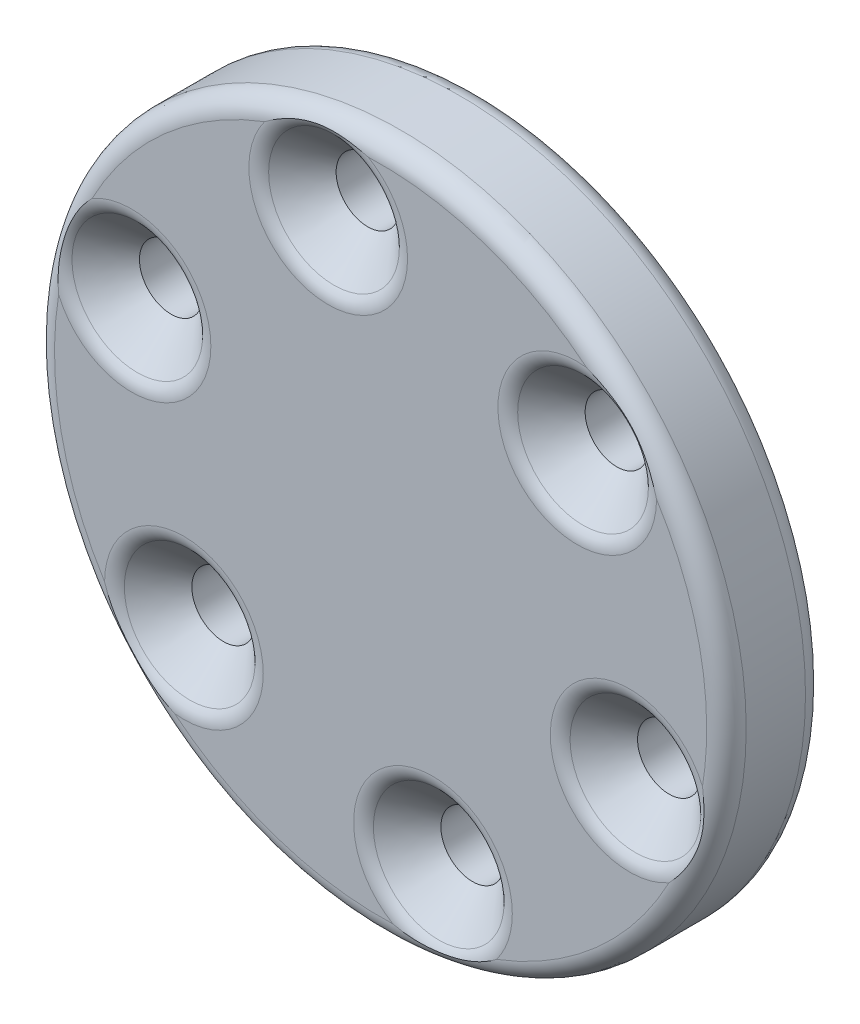
from build123d import *

# Parameters (mm, degrees)
ESQUISSE1_R        = 17.5
ESQUISSE1_R_2      = 1.6
BOSS_EXTRU_1_DEPTH = 5
CHANFREIN1_SIZE    = 2
CONG_2_R           = 1


with BuildPart() as part:
    # Esquisse1 → Boss.-Extru.1 (new body)
    with BuildSketch(Plane.XY):
        Circle(ESQUISSE1_R)
        with Locations((-2.65015328, 13.020556544)):
            Circle(ESQUISSE1_R_2, mode=Mode.SUBTRACT)
        with Locations((9.951056099, 8.805378336)):
            Circle(ESQUISSE1_R_2, mode=Mode.SUBTRACT)
        with Locations((12.601209379, -4.215178208)):
            Circle(ESQUISSE1_R_2, mode=Mode.SUBTRACT)
        with Locations((2.65015328, -13.020556544)):
            Circle(ESQUISSE1_R_2, mode=Mode.SUBTRACT)
        with Locations((-9.951056099, -8.805378336)):
            Circle(ESQUISSE1_R_2, mode=Mode.SUBTRACT)
        with Locations((-12.601209379, 4.215178208)):
            Circle(ESQUISSE1_R_2, mode=Mode.SUBTRACT)
    extrude(amount=BOSS_EXTRU_1_DEPTH)

    # Chanfrein1
    chanfrein1_edges = [part.edges().sort_by_distance(p)[0] for p in [
        (-14.201209379, 4.215178208, 5),
        (-11.551056099, -8.805378336, 5),
        (1.05015328, -13.020556544, 5),
        (11.001209379, -4.215178208, 5),
        (8.351056099, 8.805378336, 5),
        (-4.25015328, 13.020556544, 5),
    ]]
    chamfer(chanfrein1_edges, length=CHANFREIN1_SIZE)

    # Congé2
    # the kernel refuses this fillet: 1 mm, written as the material it takes off along each edge
    with BuildSketch(Plane(origin=(12.601209379, -4.215178208, 0), x_dir=(1, 0, 0), z_dir=(0, -1, 0))) as cong_2_piece_1:
        with BuildLine():
            CenterArc((1.6 + CONG_2_R, CONG_2_R), CONG_2_R, 180, 90)
            Line((1.6, CONG_2_R), (1.6, 0))
            Line((1.6, 0), (1.6 + CONG_2_R, 0))
        make_face()
    revolve(axis=Axis((12.601209379, -4.215178208, 0), (0, 0, 1)), mode=Mode.SUBTRACT)
    with BuildSketch(Plane(origin=(2.65015328, -13.020556544, 0), x_dir=(1, 0, 0), z_dir=(0, -1, 0))) as cong_2_piece_2:
        with BuildLine():
            CenterArc((1.6 + CONG_2_R, CONG_2_R), CONG_2_R, 180, 90)
            Line((1.6, CONG_2_R), (1.6, 0))
            Line((1.6, 0), (1.6 + CONG_2_R, 0))
        make_face()
    revolve(axis=Axis((2.65015328, -13.020556544, 0), (0, 0, 1)), mode=Mode.SUBTRACT)
    with BuildSketch(Plane(origin=(-9.951056099, -8.805378336, 0), x_dir=(1, 0, 0), z_dir=(0, -1, 0))) as cong_2_piece_3:
        with BuildLine():
            CenterArc((1.6 + CONG_2_R, CONG_2_R), CONG_2_R, 180, 90)
            Line((1.6, CONG_2_R), (1.6, 0))
            Line((1.6, 0), (1.6 + CONG_2_R, 0))
        make_face()
    revolve(axis=Axis((-9.951056099, -8.805378336, 0), (0, 0, 1)), mode=Mode.SUBTRACT)
    with BuildSketch(Plane(origin=(-12.601209379, 4.215178208, 0), x_dir=(1, 0, 0), z_dir=(0, -1, 0))) as cong_2_piece_4:
        with BuildLine():
            CenterArc((1.6 + CONG_2_R, CONG_2_R), CONG_2_R, 180, 90)
            Line((1.6, CONG_2_R), (1.6, 0))
            Line((1.6, 0), (1.6 + CONG_2_R, 0))
        make_face()
    revolve(axis=Axis((-12.601209379, 4.215178208, 0), (0, 0, 1)), mode=Mode.SUBTRACT)
    with BuildSketch(Plane(origin=(-12.601209379, 4.215178208, 5), x_dir=(1, 0, 0), z_dir=(0, -1, 0))) as cong_2_piece_5:
        with BuildLine():
            CenterArc((3.6 + CONG_2_R * 0.414213562373, -CONG_2_R), CONG_2_R, 90, 45)
            Line((3.6 - CONG_2_R * 0.292893218813, -CONG_2_R * 0.292893218813), (3.6, 0))
            Line((3.6, 0), (3.6 + CONG_2_R * 0.414213562373, 0))
        make_face()
    revolve(axis=Axis((-12.601209379, 4.215178208, 5), (0, 0, 1)), mode=Mode.SUBTRACT)
    with BuildSketch(Plane(origin=(-9.951056099, -8.805378336, 5), x_dir=(1, 0, 0), z_dir=(0, -1, 0))) as cong_2_piece_6:
        with BuildLine():
            CenterArc((3.6 + CONG_2_R * 0.414213562373, -CONG_2_R), CONG_2_R, 90, 45)
            Line((3.6 - CONG_2_R * 0.292893218813, -CONG_2_R * 0.292893218813), (3.6, 0))
            Line((3.6, 0), (3.6 + CONG_2_R * 0.414213562373, 0))
        make_face()
    revolve(axis=Axis((-9.951056099, -8.805378336, 5), (0, 0, 1)), mode=Mode.SUBTRACT)
    with BuildSketch(Plane(origin=(2.65015328, -13.020556544, 5), x_dir=(1, 0, 0), z_dir=(0, -1, 0))) as cong_2_piece_7:
        with BuildLine():
            CenterArc((3.6 + CONG_2_R * 0.414213562373, -CONG_2_R), CONG_2_R, 90, 45)
            Line((3.6 - CONG_2_R * 0.292893218813, -CONG_2_R * 0.292893218813), (3.6, 0))
            Line((3.6, 0), (3.6 + CONG_2_R * 0.414213562373, 0))
        make_face()
    revolve(axis=Axis((2.65015328, -13.020556544, 5), (0, 0, 1)), mode=Mode.SUBTRACT)
    with BuildSketch(Plane(origin=(12.601209379, -4.215178208, 5), x_dir=(1, 0, 0), z_dir=(0, -1, 0))) as cong_2_piece_8:
        with BuildLine():
            CenterArc((3.6 + CONG_2_R * 0.414213562373, -CONG_2_R), CONG_2_R, 90, 45)
            Line((3.6 - CONG_2_R * 0.292893218813, -CONG_2_R * 0.292893218813), (3.6, 0))
            Line((3.6, 0), (3.6 + CONG_2_R * 0.414213562373, 0))
        make_face()
    revolve(axis=Axis((12.601209379, -4.215178208, 5), (0, 0, 1)), mode=Mode.SUBTRACT)
    with BuildSketch(Plane(origin=(9.951056099, 8.805378336, 5), x_dir=(1, 0, 0), z_dir=(0, -1, 0))) as cong_2_piece_9:
        with BuildLine():
            CenterArc((3.6 + CONG_2_R * 0.414213562373, -CONG_2_R), CONG_2_R, 90, 45)
            Line((3.6 - CONG_2_R * 0.292893218813, -CONG_2_R * 0.292893218813), (3.6, 0))
            Line((3.6, 0), (3.6 + CONG_2_R * 0.414213562373, 0))
        make_face()
    revolve(axis=Axis((9.951056099, 8.805378336, 5), (0, 0, 1)), mode=Mode.SUBTRACT)
    with BuildSketch(Plane(origin=(-2.65015328, 13.020556544, 5), x_dir=(1, 0, 0), z_dir=(0, -1, 0))) as cong_2_piece_10:
        with BuildLine():
            CenterArc((3.6 + CONG_2_R * 0.414213562373, -CONG_2_R), CONG_2_R, 90, 45)
            Line((3.6 + CONG_2_R * 0.414213562373, 0), (3.6, 0))
            Line((3.6, 0), (3.6 - CONG_2_R * 0.292893218813, -CONG_2_R * 0.292893218813))
        make_face()
    revolve(axis=Axis((-2.65015328, 13.020556544, 5), (0, 0, 1)), mode=Mode.SUBTRACT)
    with BuildSketch(Plane(origin=(0, 0, 5), x_dir=(1, 0, 0), z_dir=(0, -1, 0))) as cong_2_piece_11:
        with BuildLine():
            CenterArc((17.5 - CONG_2_R, -CONG_2_R), CONG_2_R, 0, 90)
            Line((17.5, -CONG_2_R), (17.5, 0))
            Line((17.5, 0), (17.5 - CONG_2_R, 0))
        make_face()
    revolve(axis=Axis((0, 0, 5), (0, 0, 1)), mode=Mode.SUBTRACT)
    with BuildSketch(Plane(origin=(0, 0, 0), x_dir=(1, 0, 0), z_dir=(0, -1, 0))) as cong_2_piece_12:
        with BuildLine():
            CenterArc((17.5 - CONG_2_R, CONG_2_R), CONG_2_R, 270, 90)
            Line((17.5, CONG_2_R), (17.5, 0))
            Line((17.5, 0), (17.5 - CONG_2_R, 0))
        make_face()
    revolve(axis=Axis((0, 0, 0), (0, 0, 1)), mode=Mode.SUBTRACT)
    with BuildSketch(Plane(origin=(-2.65015328, 13.020556544, 0), x_dir=(1, 0, 0), z_dir=(0, -1, 0))) as cong_2_piece_13:
        with BuildLine():
            CenterArc((1.6 + CONG_2_R, CONG_2_R), CONG_2_R, 180, 90)
            Line((1.6 + CONG_2_R, 0), (1.6, 0))
            Line((1.6, 0), (1.6, CONG_2_R))
        make_face()
    revolve(axis=Axis((-2.65015328, 13.020556544, 0), (0, 0, 1)), mode=Mode.SUBTRACT)
    with BuildSketch(Plane(origin=(9.951056099, 8.805378336, 0), x_dir=(1, 0, 0), z_dir=(0, -1, 0))) as cong_2_piece_14:
        with BuildLine():
            CenterArc((1.6 + CONG_2_R, CONG_2_R), CONG_2_R, 180, 90)
            Line((1.6, CONG_2_R), (1.6, 0))
            Line((1.6, 0), (1.6 + CONG_2_R, 0))
        make_face()
    revolve(axis=Axis((9.951056099, 8.805378336, 0), (0, 0, 1)), mode=Mode.SUBTRACT)


solid = part.part
